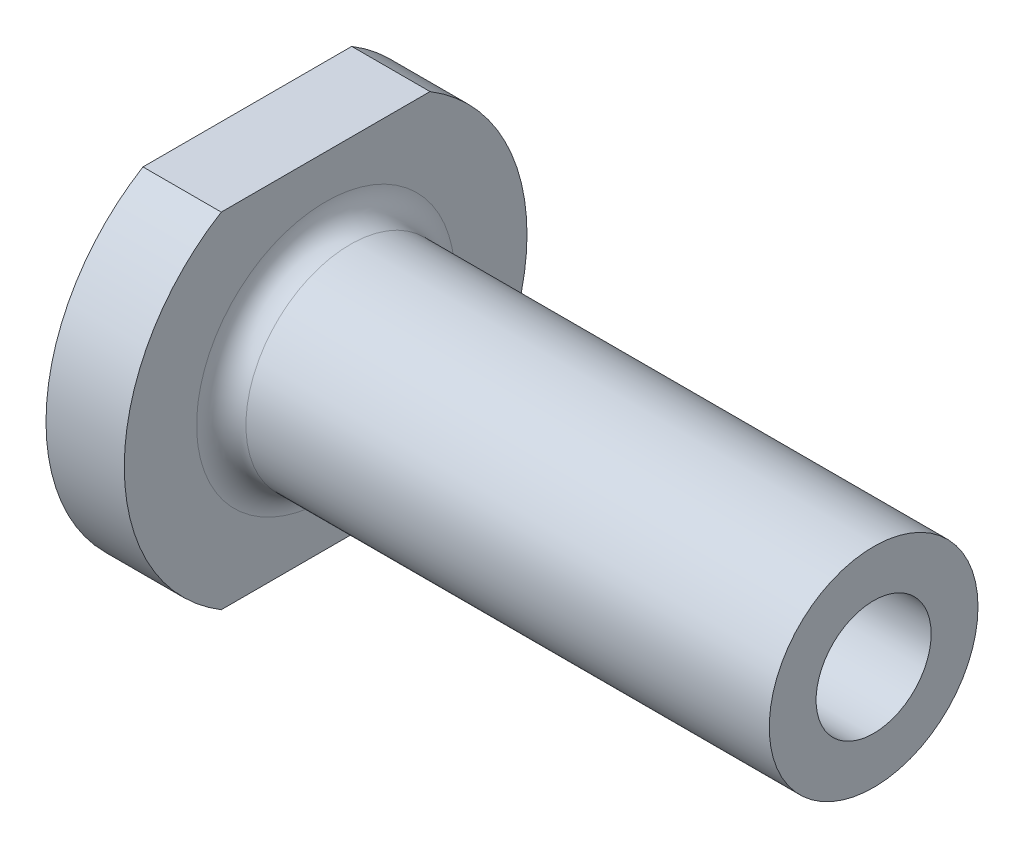
from build123d import *

# Parameters (mm, degrees)
FILLET1_R                            = 1.5
F_5_16_18_MAKE_SURE_TO_CHANGE_THIS_D = 7
CUT_EXTRUDE1_DEPTH                   = 42.853733412


with BuildPart() as part:
    # Sketch1 → Revolve1 (revolve)
    with BuildSketch(Plane.XY):
        Polygon((0, 0), (38.1, 0), (38.1, 6.35), (4.7625, 6.35), (4.7625, 12.250000011), (0, 12.250000011), align=None)
    revolve(axis=Axis((0, 0, 0), (-1, 0, 0)))

    # Fillet1
    fillet1_edges = [part.edges().sort_by_distance(p)[0] for p in [
        (4.7625, -6.35, 0),
    ]]
    fillet(fillet1_edges, radius=FILLET1_R)

    # 5/16-18 MAKE SURE TO CHANGE THIS (through all)
    with Locations(Plane(origin=(38.1, 0, 0), x_dir=(0, 0, -1), z_dir=(1, 0, 0))):
        with Locations((0, 0)):
            Hole(F_5_16_18_MAKE_SURE_TO_CHANGE_THIS_D / 2)

    # Sketch4 → Cut-Extrude1 (cut, through all)
    with BuildSketch(Plane.ZY):
        with BuildLine():
            Line((-6.35, 10.475686148), (6.35, 10.475686148))
            ThreePointArc((6.35, 10.475686148), (0, 12.250000011), (-6.35, 10.475686148))
        make_face()
        with BuildLine():
            Line((6.35, -10.475686148), (-6.35, -10.475686148))
            ThreePointArc((-6.35, -10.475686148), (0, -12.250000011), (6.35, -10.475686148))
        make_face()
    extrude(amount=-CUT_EXTRUDE1_DEPTH, mode=Mode.SUBTRACT)


solid = part.part
